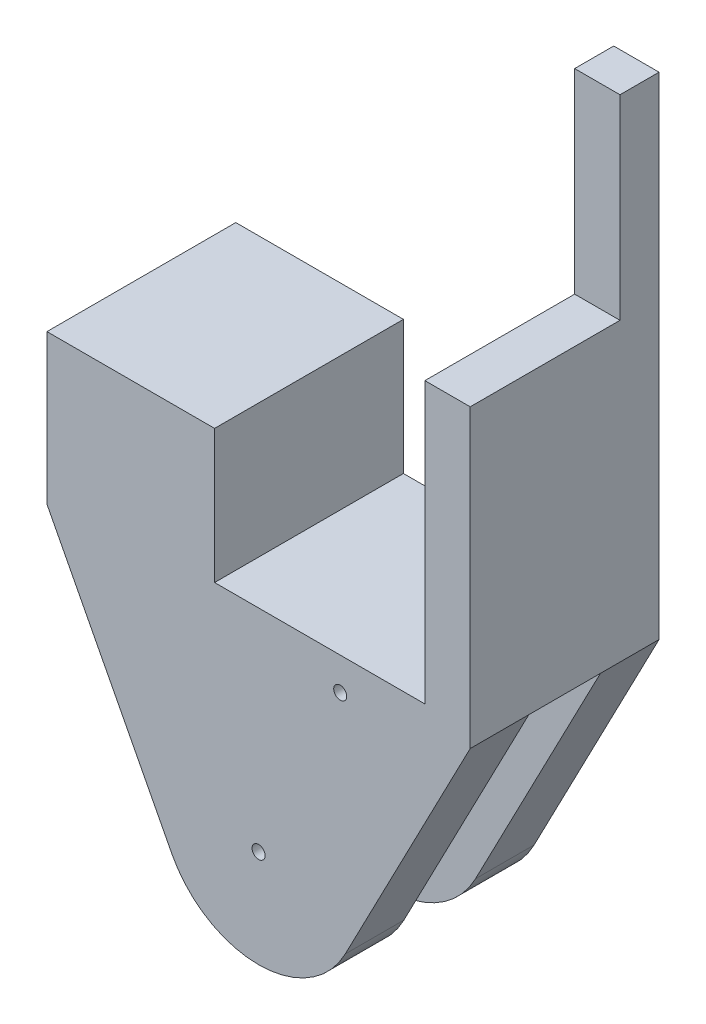
from build123d import *

# Parameters (mm, degrees)
SKETCH1_W             = 65
SKETCH1_H             = 9
BOSS_EXTRUDE1_DEPTH   = 45
BOSS_EXTRUDE1_2_DEPTH = 45
SKETCH2_R             = 1
CUT_EXTRUDE5_DEPTH    = 34
CUT_EXTRUDE6_DEPTH    = 34
SKETCH3_R             = 3
CUT_EXTRUDE7_DEPTH    = 2.45
SKETCH4_R             = 3
CUT_EXTRUDE8_DEPTH    = 2.45
SKETCH5_W             = 65
SKETCH5_H             = 29
BOSS_EXTRUDE2_DEPTH   = 2.45
SKETCH9_W             = 6.962412957
SKETCH9_H             = 29
BOSS_EXTRUDE5_DEPTH   = 73
SKETCH13_W            = 25.743716973
SKETCH13_H            = 29
BOSS_EXTRUDE6_DEPTH   = 20.5
SKETCH11_R            = 3
CUT_EXTRUDE11_DEPTH   = 2.5
SKETCH12_R            = 1
CUT_EXTRUDE12_DEPTH   = 32.5
BODY_MOVE_COPY1_ANGLE = 90
SKETCH23_W            = 23
SKETCH23_H            = 30
CUT_EXTRUDE18_DEPTH   = 10


with BuildPart() as part:
    # Sketch1 → Boss-Extrude1 (new body)
    with BuildSketch(Plane.XY):
        with Locations((32.5, 15.5)):
            Rectangle(SKETCH1_W, SKETCH1_H)
    extrude(amount=BOSS_EXTRUDE1_DEPTH)


with BuildPart() as body_2:
    # Sketch1 → Boss-Extrude1 2 (new body)
    with BuildSketch(Plane.XY):
        with Locations((32.5, 35.5)):
            Rectangle(SKETCH1_W, SKETCH1_H)
    extrude(amount=BOSS_EXTRUDE1_2_DEPTH)


with BuildPart() as cut_extrude5_tool:
    # Sketch2 → Cut-Extrude5 (new body)
    with BuildSketch(Plane.XZ.offset(-10)):
        with BuildLine():
            ThreePointArc((45.80925577, 8.081639583), (40.285389963, 2.178623197), (32.5, 0))
            Line((32.5, 0), (65, 0))
            Line((65, 0), (65, 45))
            Line((65, 45), (45.80925577, 8.081639583))
        make_face()
        with Locations((32.5, 15)):
            Circle(SKETCH2_R)
    extrude(amount=-CUT_EXTRUDE5_DEPTH)


with BuildPart() as part_1:
    add(part.part)

    # Cut-Extrude5: cut by cut_extrude5_tool
    add(cut_extrude5_tool.part, mode=Mode.SUBTRACT)


with BuildPart() as body_2_1:
    add(body_2.part)

    # Cut-Extrude5: cut by cut_extrude5_tool
    add(cut_extrude5_tool.part, mode=Mode.SUBTRACT)


with BuildPart() as cut_extrude6_tool:
    # Sketch2<6> → Cut-Extrude6 (new body)
    with BuildSketch(Plane.XZ.offset(-10)):
        with BuildLine():
            Line((19.19074423, 8.081639583), (0, 45))
            Line((0, 45), (0, 0))
            Line((0, 0), (32.5, 0))
            ThreePointArc((32.5, 0), (24.714610037, 2.178623197), (19.19074423, 8.081639583))
        make_face()
    extrude(amount=-CUT_EXTRUDE6_DEPTH)


with BuildPart() as part_2:
    add(part_1.part)

    # Cut-Extrude6: cut by cut_extrude6_tool
    add(cut_extrude6_tool.part, mode=Mode.SUBTRACT)

    # Sketch4 → Cut-Extrude8 (cut)
    with BuildSketch(Plane(origin=(0, 20, 0), x_dir=(1, 0, 0), z_dir=(0, 1, 0))):
        with Locations((32.5, -15)):
            Circle(SKETCH4_R)
    extrude(amount=-CUT_EXTRUDE8_DEPTH, mode=Mode.SUBTRACT)



with BuildPart() as body_2_2:
    add(body_2_1.part)

    # Cut-Extrude6: cut by cut_extrude6_tool
    add(cut_extrude6_tool.part, mode=Mode.SUBTRACT)

    # Sketch3 → Cut-Extrude7 (cut)
    with BuildSketch(Plane(origin=(0, 40, 0), x_dir=(1, 0, 0), z_dir=(0, 1, 0))):
        with Locations((32.5, -15)):
            Circle(SKETCH3_R)
    extrude(amount=-CUT_EXTRUDE7_DEPTH, mode=Mode.SUBTRACT)


with BuildPart() as part_3:
    add(part_2.part)

    add(body_2_2.part)  # Boss-Extrude2 merges body 2
    # Sketch5 → Boss-Extrude2 (add)
    with BuildSketch(Plane.XY.offset(45)):
        with Locations((32.5, 25.5)):
            Rectangle(SKETCH5_W, SKETCH5_H)
    extrude(amount=BOSS_EXTRUDE2_DEPTH)

    # Sketch9 → Boss-Extrude5 (add)
    with BuildSketch(Plane.XY.offset(47.45)):
        with Locations((61.518793522, 25.5)):
            Rectangle(SKETCH9_W, SKETCH9_H)
    extrude(amount=BOSS_EXTRUDE5_DEPTH)

    # Sketch13 → Boss-Extrude6 (add)
    with BuildSketch(Plane.XY.offset(47.45)):
        with Locations((12.871858487, 25.5)):
            Rectangle(SKETCH13_W, SKETCH13_H)
    extrude(amount=BOSS_EXTRUDE6_DEPTH)

    # Sketch11 → Cut-Extrude11 (cut)
    with BuildSketch(Plane(origin=(0, 40, 0), x_dir=(1, 0, 0), z_dir=(0, 1, 0))):
        with Locations((45.037587043, -42.45)):
            Circle(SKETCH11_R)
    extrude(amount=-CUT_EXTRUDE11_DEPTH, mode=Mode.SUBTRACT)

    # Sketch12 → Cut-Extrude12 (cut)
    with BuildSketch(Plane(origin=(0, 37.5, 0), x_dir=(1, 0, 0), z_dir=(0, 1, 0))):
        with Locations((45.037587043, -42.45)):
            Circle(SKETCH12_R)
    extrude(amount=-CUT_EXTRUDE12_DEPTH, mode=Mode.SUBTRACT)


with BuildPart() as part_4:
    # Body-Move/Copy1: moved
    add(part_3.part.rotate(Axis((0, 25.5, 60.225), (-1, 0, 0)), BODY_MOVE_COPY1_ANGLE))


with BuildPart() as part_5:
    # Body-Move/Copy2: moved
    add(part_4.part.moved(Location((-32.5, 19.725, -45.725))))

    # Sketch23 → Cut-Extrude18 (cut)
    with BuildSketch(Plane.ZY.offset(-25.537587043)):
        with Locations((17.5, 90.45)):
            Rectangle(SKETCH23_W, SKETCH23_H)
    extrude(amount=-CUT_EXTRUDE18_DEPTH, mode=Mode.SUBTRACT)


solid = part_5.part
